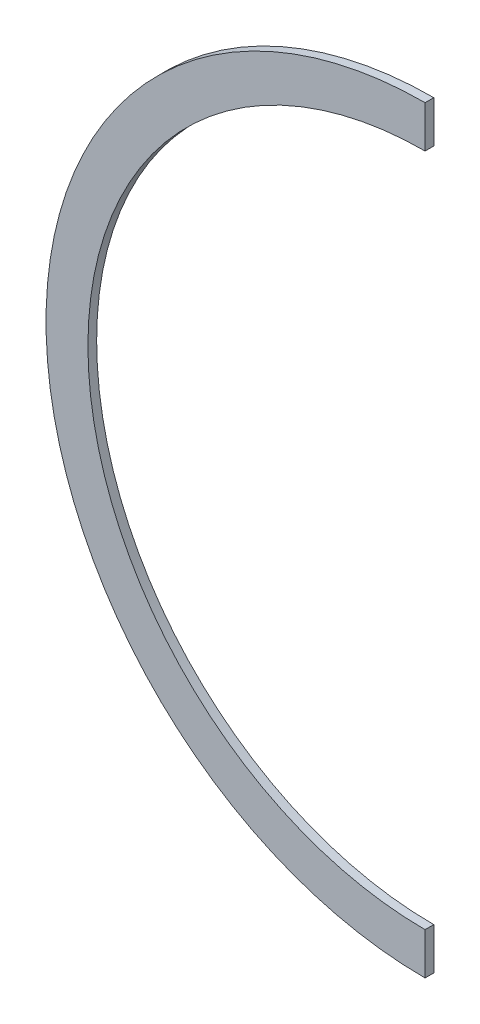
from build123d import *

# Parameters (mm, degrees)
SKETCH2_R           = 137.922
SKETCH2_R_2         = 122.682
BOSS_EXTRUDE2_DEPTH = 1.5875
SKETCH3_W           = 290.977734258
SKETCH3_H           = 504.828840158
CUT_EXTRUDE1_DEPTH  = 205.235122161


with BuildPart() as part:
    # Sketch2 → Boss-Extrude2 (new, symmetric)
    with BuildSketch(Plane(origin=(248.273568551, -245.01347209, 0), x_dir=(0, -1, 0), z_dir=(0, 0, -1))):
        with Locations((-257.71347209, 248.273568551)):
            Circle(SKETCH2_R)
        with Locations((-257.71347209, 248.273568551)):
            Circle(SKETCH2_R_2, mode=Mode.SUBTRACT)
    extrude(amount=BOSS_EXTRUDE2_DEPTH, both=True)

    # Sketch3 → Cut-Extrude1 (cut, through all)
    with BuildSketch(Plane(origin=(0, 0, 0), x_dir=(0, 0, -1), z_dir=(1, 0, 0))):
        with Locations((4.206907001, 10.947122083)):
            Rectangle(SKETCH3_W, SKETCH3_H)
    extrude(amount=CUT_EXTRUDE1_DEPTH, mode=Mode.SUBTRACT)


solid = part.part
